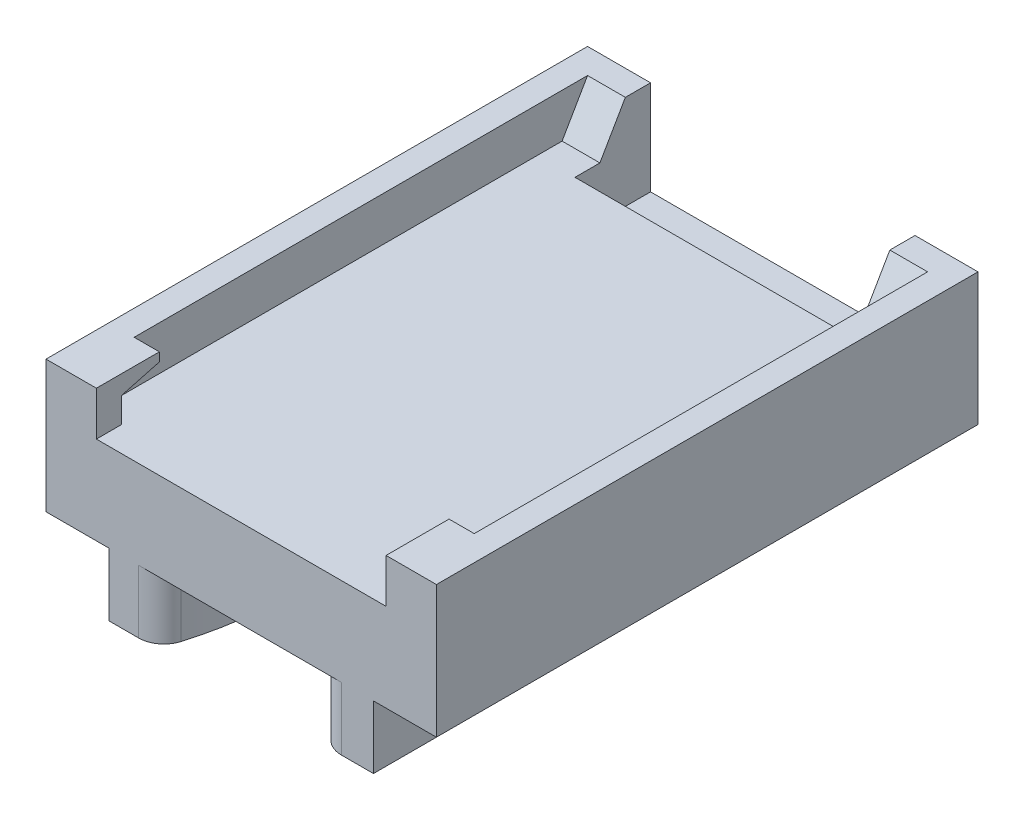
from build123d import *
from OCP.BRepFilletAPI import BRepFilletAPI_MakeChamfer

# Parameters (mm, degrees)
SZKIC1_W                    = 31
SZKIC1_H                    = 43
DODANIE_WYCI_GNI_CIE1_DEPTH = 12
DODANIE_WYCI_GNI_CIE3_DEPTH = 5
SZKIC4_W                    = 5
SZKIC4_H                    = 43
WYTNIJ_WYCI_GNI_CIE1_DEPTH  = 5
DODANIE_WYCI_GNI_CIE4_DEPTH = 3.5
SZKIC6_W                    = 21
SZKIC6_H                    = 6
WYTNIJ_WYCI_GNI_CIE2_DEPTH  = 4
SFAZOWANIE1_SIZE2           = 3.356398525
SFAZOWANIE1_SIZE            = 4
SFAZOWANIE2_SIZE            = 2.020725942
SFAZOWANIE2_SIZE_2          = 3.5
ZAOKR_GLENIE2_R             = 2
SZKIC7_W                    = 2
SZKIC7_H                    = 1.5
DODANIE_WYCI_GNI_CIE5_DEPTH = 3
SFAZOWANIE3_SIZE            = 3
SFAZOWANIE3_SIZE_2          = 0.803847577


with BuildPart() as part:
    # Szkic1 → Dodanie-wyciągnięcie1 (new body)
    with BuildSketch(Plane(origin=(0, 0, 0), x_dir=(1, 0, 0), z_dir=(0, 1, 0))):
        Rectangle(SZKIC1_W, SZKIC1_H)
    extrude(amount=DODANIE_WYCI_GNI_CIE1_DEPTH)


with BuildPart() as body_2:
    # Szkic3 → Dodanie-wyciągnięcie3 (new body)
    with BuildSketch(Plane.XZ):
        with BuildLine():
            Line((-10.212337084, 28.112329696), (-14.125358878, 33.459474506))
            ThreePointArc((-14.125358878, 33.459474506), (-14.461615087, 35.767305941), (-12.741502742, 37.342224254))
            ThreePointArc((-12.741502742, 37.342224254), (-8.998415843, 41.011293853), (-10.279093338, 46.09387552))
            Line((-10.279093338, 46.09387552), (-15.166024728, 51.154438355))
            ThreePointArc((-15.166024728, 51.154438355), (-15.686793901, 52.037661779), (-15.750705614, 53.06098941))
            ThreePointArc((-15.750705614, 53.06098941), (-13.686472686, 56.384695233), (-10.429010158, 58.55195522))
            ThreePointArc((-10.429010158, 58.55195522), (-9.157993267, 58.652708308), (-8.044536022, 58.031541594))
            Line((-8.044536022, 58.031541594), (-4.224518095, 54.075788657))
            ThreePointArc((-4.224518095, 54.075788657), (0.407878305, 52.061536199), (5.107784388, 53.912803922))
            Line((5.107784388, 53.912803922), (9.063616274, 57.732769227))
            ThreePointArc((9.063616274, 57.732769227), (9.946850008, 58.253523329), (10.970179942, 58.317417838))
            ThreePointArc((10.970179942, 58.317417838), (12.642937927, 57.562348173), (14.103566869, 56.451126968))
            ThreePointArc((14.103566869, 56.451126968), (15.47806196, 54.856926305), (16.461051962, 52.995624834))
            ThreePointArc((16.461051962, 52.995624834), (16.56178137, 51.724613884), (15.94059861, 50.611174515))
            Line((15.94059861, 50.611174515), (10.879953282, 45.72434942))
            ThreePointArc((10.879953282, 45.72434942), (9.272518926, 41.94367997), (10.871160741, 38.159284239))
            ThreePointArc((10.871160741, 38.159284239), (11.521401414, 37.62253212), (12.248997344, 37.19648056))
            ThreePointArc((12.248997344, 37.19648056), (13.149955836, 36.868062858), (13.971590322, 36.373592268))
            ThreePointArc((13.971590322, 36.373592268), (14.805880692, 34.730389937), (14.282706099, 32.963346456))
            ThreePointArc((14.282706099, 32.963346456), (9.465690514, 26.653949977), (5.828617709, 19.59818464))
            ThreePointArc((5.828617709, 19.59818464), (4.786614899, 15.065901025), (4.553521224, 10.421223215))
            Line((4.553521224, 10.421223215), (7.14350853, -58.109023822))
            ThreePointArc((7.14350853, -58.109023822), (7.019012284, -59.657823394), (6.535877134, -61.134596855))
            Line((6.535877134, -61.134596855), (1.314918151, -72.39460248))
            ThreePointArc((1.314918151, -72.39460248), (-1.069105556, -73.746830857), (-3.119902204, -71.928500927))
            Line((-3.119902204, -71.928500927), (-5.8858069, -59.829088544))
            ThreePointArc((-5.8858069, -59.829088544), (-6.014905284, -59.054960819), (-6.051200692, -58.27098201))
            Line((-6.051200692, -58.27098201), (-5.119340887, 12.172423843))
            ThreePointArc((-5.119340887, 12.172423843), (-6.369476529, 20.556580537), (-10.212337084, 28.112329696))
        make_face()
    extrude(amount=-DODANIE_WYCI_GNI_CIE3_DEPTH)


with BuildPart() as part_1:
    add(part.part)

    # Połącz1: cut body 2
    add(body_2.part, mode=Mode.SUBTRACT)

    # Szkic4 → Wytnij-wyciągnięcie1 (cut)
    with BuildSketch(Plane.XZ):
        with Locations((13, 0)):
            Rectangle(SZKIC4_W, SZKIC4_H)
        with Locations((-13, 0)):
            Rectangle(SZKIC4_W, SZKIC4_H)
    extrude(amount=-WYTNIJ_WYCI_GNI_CIE1_DEPTH, mode=Mode.SUBTRACT)

    # Szkic5 → Dodanie-wyciągnięcie4 (add)
    with BuildSketch(Plane(origin=(0, 12, 0), x_dir=(1, 0, 0), z_dir=(0, 1, 0))):
        Polygon((10.5, 19.5), (10.5, 21.5), (15.5, 21.5), (15.5, -21.5), (11.5, -21.5), (11.5, -19.5), (13.5, -19.5), (13.5, 19.5), align=None)
        Polygon((-15.5, 21.5), (-15.5, -21.5), (-11.5, -21.5), (-11.5, -19.5), (-13.5, -19.5), (-13.5, 19.5), (-10.5, 19.5), (-10.5, 21.5), align=None)
    extrude(amount=DODANIE_WYCI_GNI_CIE4_DEPTH)

    # Szkic6 → Wytnij-wyciągnięcie2 (cut)
    with BuildSketch(Plane(origin=(0, 12, 0), x_dir=(1, 0, 0), z_dir=(0, 1, 0))):
        with Locations((0, 18.5)):
            Rectangle(SZKIC6_W, SZKIC6_H)
    extrude(amount=-WYTNIJ_WYCI_GNI_CIE2_DEPTH, mode=Mode.SUBTRACT)

    # Sfazowanie1
    sfazowanie1_edges = [part_1.edges().sort_by_distance(p)[0] for p in [
        (0, 8, -15.5),
    ]]
    sfazowanie1_side = [part_1.faces().sort_by_distance(p)[0] for p in [
        (0, 8.06712797, -15.5),
    ]]
    chamfer(sfazowanie1_edges, length=SFAZOWANIE1_SIZE - 0.0001, length2=SFAZOWANIE1_SIZE2 - 0.0001, reference=sfazowanie1_side[0])  # a hair under: the kernel refuses the full size

    # Sfazowanie2
    sfazowanie2_edges_1 = [part_1.edges().sort_by_distance(p)[0] for p in [
        (12, 12, -19.5),
    ]]
    sfazowanie2_side_1 = [part_1.faces().sort_by_distance(p)[0] for p in [
        (12, 12, -19.459585481),
    ]]
    sfazowanie2_edges_2 = [part_1.edges().sort_by_distance(p)[0] for p in [
        (-12, 12, -19.5),
    ]]
    sfazowanie2_side_2 = [part_1.faces().sort_by_distance(p)[0] for p in [
        (-12, 12, -19.459585481),
    ]]
    sfazowanie2 = BRepFilletAPI_MakeChamfer(part_1.part.solid().wrapped)
    for e in sfazowanie2_edges_1:
        sfazowanie2.Add(SFAZOWANIE2_SIZE - 0.0001, SFAZOWANIE2_SIZE_2 - 0.0001, e.wrapped, sfazowanie2_side_1[0].wrapped)
    for e in sfazowanie2_edges_2:
        sfazowanie2.Add(SFAZOWANIE2_SIZE - 0.0001, SFAZOWANIE2_SIZE_2 - 0.0001, e.wrapped, sfazowanie2_side_2[0].wrapped)
    add(Compound.cast(sfazowanie2.Shape()), mode=Mode.REPLACE)  # a hair under: the kernel refuses the full size

    # Zaokrąglenie2
    zaokr_glenie2_edges = [part_1.edges().sort_by_distance(p)[0] for p in [
        (-6.690658064, 2.5, 21.5),
        (6.65719404, 2.5, 21.5),
    ]]
    fillet(zaokr_glenie2_edges, radius=ZAOKR_GLENIE2_R)

    # Szkic7 → Dodanie-wyciągnięcie5 (add)
    with BuildSketch(Plane(origin=(0, 0, 19.5), x_dir=(-1, 0, 0), z_dir=(0, 0, -1))):
        with Locations((12.5, 14.75)):
            Rectangle(SZKIC7_W, SZKIC7_H)
        with Locations((-12.5, 14.75)):
            Rectangle(SZKIC7_W, SZKIC7_H)
    extrude(amount=DODANIE_WYCI_GNI_CIE5_DEPTH)

    # Sfazowanie3
    sfazowanie3_edges_1 = [part_1.edges().sort_by_distance(p)[0] for p in [
        (-12.5, 14, 16.5),
    ]]
    sfazowanie3_side_1 = [part_1.faces().sort_by_distance(p)[0] for p in [
        (-12.5, 14, 16.516076952),
    ]]
    sfazowanie3_edges_2 = [part_1.edges().sort_by_distance(p)[0] for p in [
        (12.5, 14, 16.5),
    ]]
    sfazowanie3_side_2 = [part_1.faces().sort_by_distance(p)[0] for p in [
        (12.5, 14, 16.516076952),
    ]]
    sfazowanie3 = BRepFilletAPI_MakeChamfer(part_1.part.solid().wrapped)
    for e in sfazowanie3_edges_1:
        sfazowanie3.Add(SFAZOWANIE3_SIZE - 0.0001, SFAZOWANIE3_SIZE_2 - 0.0001, e.wrapped, sfazowanie3_side_1[0].wrapped)
    for e in sfazowanie3_edges_2:
        sfazowanie3.Add(SFAZOWANIE3_SIZE - 0.0001, SFAZOWANIE3_SIZE_2 - 0.0001, e.wrapped, sfazowanie3_side_2[0].wrapped)
    add(Compound.cast(sfazowanie3.Shape()), mode=Mode.REPLACE)  # a hair under: the kernel refuses the full size


solid = part_1.part
